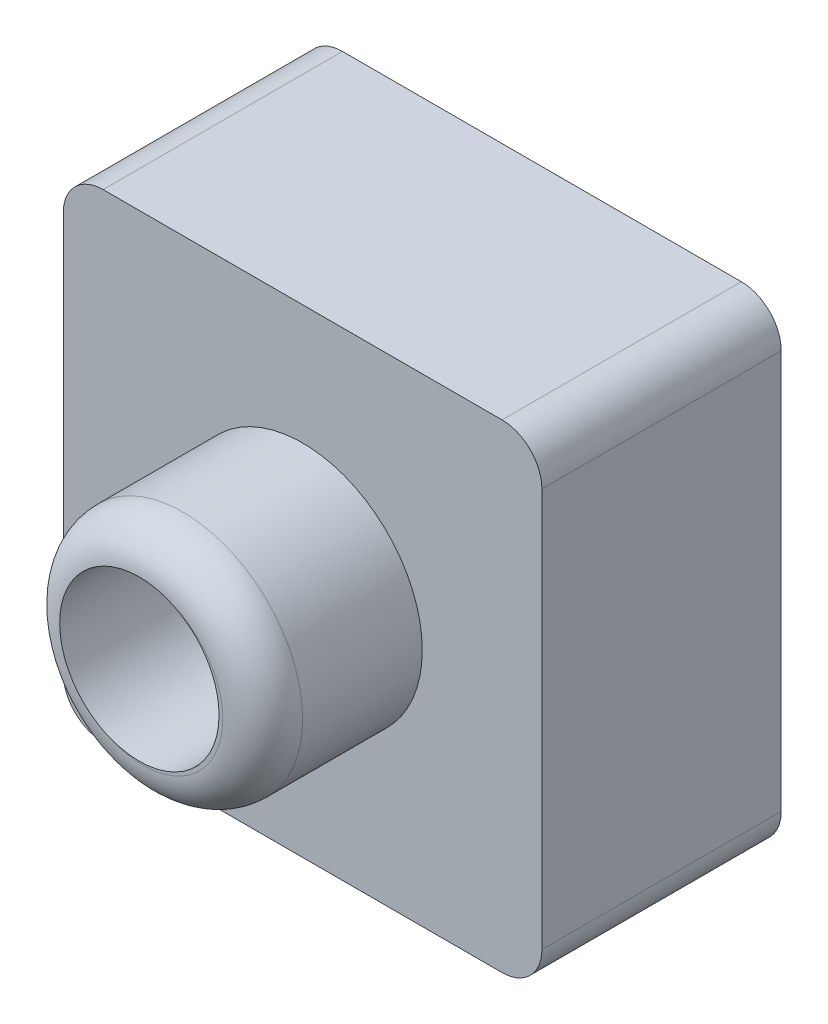
from build123d import *

# Parameters (mm, degrees)
SKETCH2_W               = 3048
SKETCH2_H               = 3048
BOSS_EXTRUDE1_DEPTH     = 1524
SKETCH3_R               = 762
BOSS_EXTRUDE2_DEPTH     = 1016
CUT_EXTRUDE1_DEPTH      = 4387.130048435
CUT_EXTRUDE1_DEPTH_BACK = 4387.130048435
SKETCH8_R               = 508
FILLET1_R               = 254
SHELL1_T                = -50.8


with BuildPart() as part:
    # Sketch2 → Boss-Extrude1 (new body)
    with BuildSketch(Plane.XY):
        with Locations((1524, 345.821596244)):
            Rectangle(SKETCH2_W, SKETCH2_H)
    extrude(amount=BOSS_EXTRUDE1_DEPTH)

    # Sketch3 → Boss-Extrude2 (add)
    with BuildSketch(Plane.XY.offset(1524)):
        with Locations((1524, 345.821596244)):
            Circle(SKETCH3_R)
    extrude(amount=BOSS_EXTRUDE2_DEPTH)

    # Sketch8 → Cut-Extrude1 (cut, two sides: drawn at the far end of the back side and taken through both)
    with BuildSketch(Plane.XY.offset(2540).offset(-CUT_EXTRUDE1_DEPTH_BACK)):
        with Locations((1500.065105654, 356.459327065)):
            Circle(SKETCH8_R)
    extrude(amount=CUT_EXTRUDE1_DEPTH + CUT_EXTRUDE1_DEPTH_BACK, mode=Mode.SUBTRACT)

    # Fillet1
    # the kernel refuses this fillet: 254 mm, written as the material it takes off along each edge
    with BuildSketch(Plane(origin=(1524, 345.821596244, 2540), x_dir=(1, 0, 0), z_dir=(0, -1, 0))) as fillet1_piece_1:
        with BuildLine():
            CenterArc((762 - FILLET1_R, -FILLET1_R), FILLET1_R, 0, 90)
            Line((762 - FILLET1_R, 0), (762, 0))
            Line((762, 0), (762, -FILLET1_R))
        make_face()
    revolve(axis=Axis((1524, 345.821596244, 2540), (0, 0, 1)), mode=Mode.SUBTRACT)
    with BuildSketch(Plane(origin=(0, 1869.821596244, -635), x_dir=(0, -1, 0), z_dir=(0, 0, 1)), Plane(origin=(0, -1178.178403756, -635), x_dir=(1, 0, 0), z_dir=(0, 0, 1))) as fillet1_piece_2:
        with BuildLine():
            CenterArc((FILLET1_R, FILLET1_R), FILLET1_R, 180, 90)
            Line((0, FILLET1_R), (0, 0))
            Line((0, 0), (FILLET1_R, 0))
        make_face()
    extrude(amount=2794, mode=Mode.SUBTRACT)
    with BuildSketch(Plane(origin=(3048, 1869.821596244, -635), x_dir=(0, -1, 0), z_dir=(0, 0, 1)), Plane(origin=(3048, -1178.178403756, -635), x_dir=(-1, 0, 0), z_dir=(0, 0, 1))) as fillet1_piece_3:
        with BuildLine():
            CenterArc((FILLET1_R, -FILLET1_R), FILLET1_R, 90, 90)
            Line((0, -FILLET1_R), (0, 0))
            Line((0, 0), (FILLET1_R, 0))
        make_face()
    extrude(amount=2794, mode=Mode.SUBTRACT)

    # Shell1
    shell1_openings = [part.faces().sort_by_distance(p)[0] for p in [
        (104.874877579, -1073.303526177, 0),
    ]]
    offset(amount=SHELL1_T, openings=shell1_openings, kind=Kind.INTERSECTION)


solid = part.part
